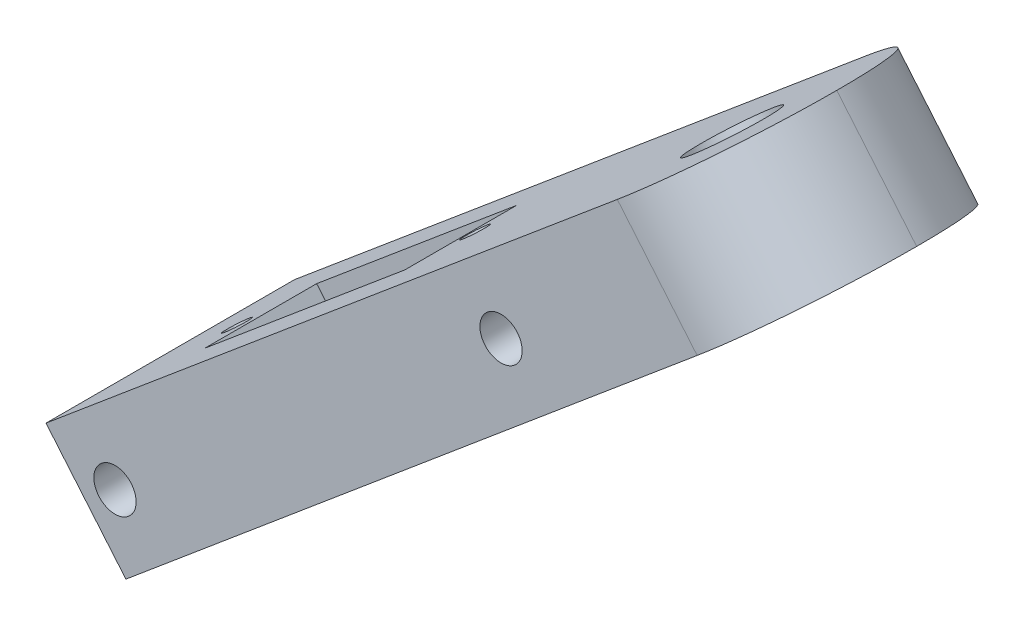
from build123d import *

# Parameters (mm, degrees)
SKETCH_1_W          = 70
SKETCH_1_H          = 20
SKETCH_1_W_2        = 21
SKETCH_1_H_2        = 9
EXTRUDE_1_DEPTH     = 10
CUT_EXTRUDE_1_REACH = 57.98
SKETCH_3_R          = 3.3
SKETCH_3_R_2        = 1
CUT_EXTRUDE_2_REACH = 60.746
SKETCH_4_R          = 1.7
FILLET_1_R          = 10


with BuildPart() as part:
    # 草图1 → 凸台-拉伸1 (new body)
    with BuildSketch(Plane(origin=(0, 0, 0), x_dir=(0.7660444431189771, 0.6427876096865406, 0), z_dir=(-0.6427876096865406, 0.7660444431189771, 0))):
        with Locations((15, 0)):
            Rectangle(SKETCH_1_W, SKETCH_1_H)
        Rectangle(SKETCH_1_W_2, SKETCH_1_H_2, mode=Mode.SUBTRACT)
    extrude(amount=EXTRUDE_1_DEPTH)

    # 草图3 → 切除-拉伸1 (cut, up to next)
    with BuildSketch(Plane(origin=(-6.427876097, 7.660444431, 0), x_dir=(0.7660444431189771, 0.6427876096865406, 0), z_dir=(-0.6427876096865405, 0.766044443118977, 0)), mode=Mode.PRIVATE) as cut_extrude_1_sk1:
        with Locations(Location((39, 0, 0), (0, 0, 180))):
            Circle(SKETCH_3_R)
    cut_extrude_1_tool1 = extrude(cut_extrude_1_sk1.sketch, amount=-CUT_EXTRUDE_1_REACH, mode=Mode.PRIVATE) & part.part
    # 草图3 → 切除-拉伸1 (cut, up to next)
    with BuildSketch(Plane(origin=(-6.427876097, 7.660444431, 0), x_dir=(0.7660444431189771, 0.6427876096865406, 0), z_dir=(-0.6427876096865405, 0.766044443118977, 0)), mode=Mode.PRIVATE) as cut_extrude_1_sk2:
        with Locations(Location((-13, 0, 0), (0, 0, 180))):
            Circle(SKETCH_3_R_2)
    cut_extrude_1_tool2 = extrude(cut_extrude_1_sk2.sketch, amount=-CUT_EXTRUDE_1_REACH, mode=Mode.PRIVATE) & part.part
    # 草图3 → 切除-拉伸1 (cut, up to next)
    with BuildSketch(Plane(origin=(-6.427876097, 7.660444431, 0), x_dir=(0.7660444431189771, 0.6427876096865406, 0), z_dir=(-0.6427876096865405, 0.766044443118977, 0)), mode=Mode.PRIVATE) as cut_extrude_1_sk3:
        with Locations(Location((12, 0, 0), (0, 0, 180))):
            Circle(SKETCH_3_R_2)
    cut_extrude_1_tool3 = extrude(cut_extrude_1_sk3.sketch, amount=-CUT_EXTRUDE_1_REACH, mode=Mode.PRIVATE) & part.part
    add(cut_extrude_1_tool1.solids().sort_by_distance((23.447857, 32.729161, 0))[0], mode=Mode.SUBTRACT)
    add(cut_extrude_1_tool2.solids().sort_by_distance((-16.386454, -0.695794, 0))[0], mode=Mode.SUBTRACT)
    add(cut_extrude_1_tool3.solids().sort_by_distance((2.764657, 15.373896, 0))[0], mode=Mode.SUBTRACT)

    # 草图4 → 切除-拉伸2 (cut, up to next)
    with BuildSketch(Plane.XY.offset(10), mode=Mode.PRIVATE) as cut_extrude_2_sk1:
        with Locations((-16.198218668, -7.064882864)):
            Circle(SKETCH_4_R)
    cut_extrude_2_tool1 = extrude(cut_extrude_2_sk1.sketch, amount=-CUT_EXTRUDE_2_REACH, mode=Mode.PRIVATE) & part.part
    # 草图4 → 切除-拉伸2 (cut, up to next)
    with BuildSketch(Plane.XY.offset(10), mode=Mode.PRIVATE) as cut_extrude_2_sk2:
        with Locations((14.862649296, 18.998279989)):
            Circle(SKETCH_4_R)
    cut_extrude_2_tool2 = extrude(cut_extrude_2_sk2.sketch, amount=-CUT_EXTRUDE_2_REACH, mode=Mode.PRIVATE) & part.part
    add(cut_extrude_2_tool1.solids().sort_by_distance((-16.198219, -7.064883, 10))[0], mode=Mode.SUBTRACT)
    add(cut_extrude_2_tool2.solids().sort_by_distance((14.862649, 18.99828, 10))[0], mode=Mode.SUBTRACT)

    # 圆角1
    fillet_1_edges = [part.edges().sort_by_distance(p)[0] for p in [
        (35.088284108, 35.9696027, -10),
        (35.088284108, 35.9696027, 10),
    ]]
    fillet(fillet_1_edges, radius=FILLET_1_R - 0.0001)  # a hair under: the kernel refuses the full size


solid = part.part
